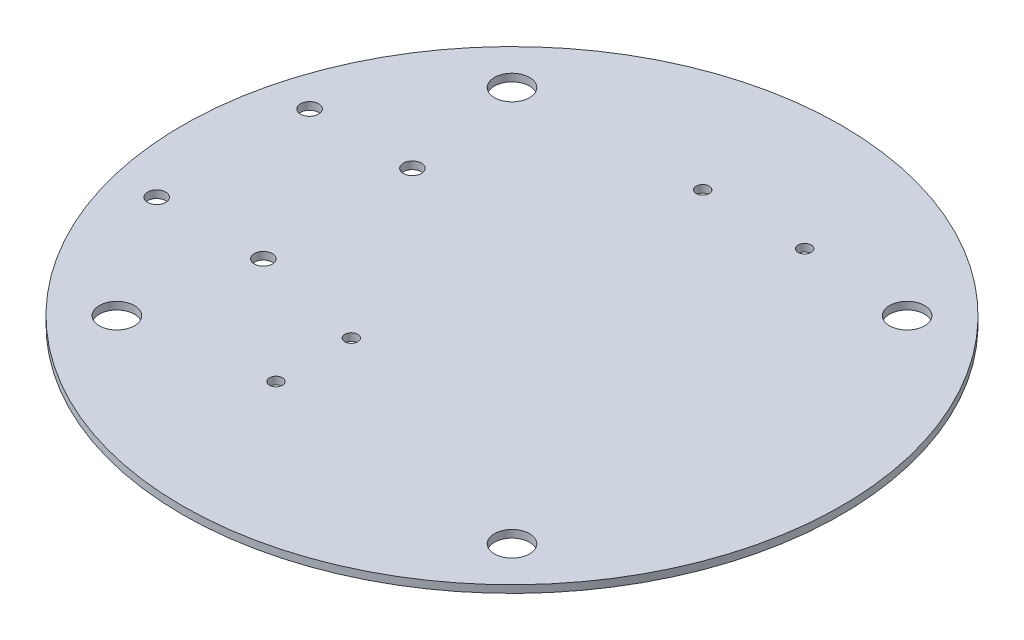
from build123d import *

# Parameters (mm, degrees)
SKETCH1_R            = 65.7
BOSS_EXTRUDE1_DEPTH  = 1.5
M6_CLEARANCE_HOLE1_D = 7
CIRPATTERN1_COUNT    = 4
M2_CLEARANCE_HOLE1_D = 2.6
M3_CLEARANCE_HOLE2_D = 3.6


with BuildPart() as part:
    # Sketch1 → Boss-Extrude1 (new body)
    with BuildSketch(Plane(origin=(0, 0, 0), x_dir=(1, 0, 0), z_dir=(0, 1, 0))):
        Circle(SKETCH1_R)
    extrude(amount=BOSS_EXTRUDE1_DEPTH)

    # M6 Clearance Hole1 (through all)
    with Locations(Plane(origin=(0, 1.5, 0), x_dir=(1, 0, 0), z_dir=(0, 1, 0))):
        with Locations((-39.385847712, -39.385847712)):
            m6_clearance_hole1 = Hole(M6_CLEARANCE_HOLE1_D / 2)

    # CirPattern1: M6 Clearance Hole1 ×4 about axis
    cirpattern1_axis = Axis((0, 1.5, 0), (0, -1, 0))
    for i in range(1, CIRPATTERN1_COUNT):
        add(m6_clearance_hole1.rotate(cirpattern1_axis, i * 360 / CIRPATTERN1_COUNT), mode=Mode.SUBTRACT)

    # M2 Clearance Hole1 (through all)
    with Locations(Plane(origin=(0, 1.5, 0), x_dir=(1, 0, 0), z_dir=(0, 1, 0))):
        with Locations((-2.709999951, 40.730000111), (17.610000128, 40.730000136), (-12.154, -19.885847712), (-12.154, -34.885847712)):
            Hole(M2_CLEARANCE_HOLE1_D / 2)

    # M3 Clearance Hole2 (through all)
    with Locations(Plane(origin=(0, 1.5, 0), x_dir=(1, 0, 0), z_dir=(0, 1, 0))):
        with Locations((-55.86454119, 15.511690642), (-55.864546519, -14.968309358), (-34.604546519, -14.968313075), (-35.36654119, 15.511687058)):
            Hole(M3_CLEARANCE_HOLE2_D / 2)


solid = part.part
